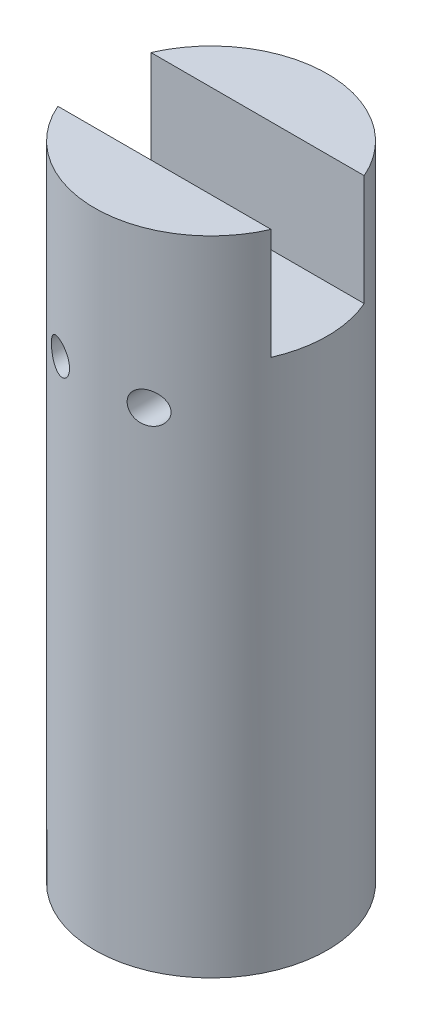
from build123d import *

# Parameters (mm, degrees)
SKETCH1_R               = 26.25
BOSS_EXTRUDE1_DEPTH     = 145
CUT_EXTRUDE1_DEPTH      = 25
CUT_EXTRUDE2_DEPTH      = 150.676734999
CUT_EXTRUDE2_DEPTH_BACK = 150.676734999
SKETCH3_R               = 3.5
SKETCH4_R               = 3.95
BOSS_EXTRUDE2_DEPTH     = 7
SKETCH5_R               = 5
BOSS_EXTRUDE3_DEPTH     = 1


with BuildPart() as part:
    # Sketch1 → Boss-Extrude1 (new body)
    with BuildSketch(Plane(origin=(0, 0, 0), x_dir=(1, 0, 0), z_dir=(0, 1, 0))):
        Circle(SKETCH1_R)
    extrude(amount=BOSS_EXTRUDE1_DEPTH)

    # Sketch2 → Cut-Extrude1 (cut)
    with BuildSketch(Plane(origin=(0, 145, 0), x_dir=(1, 0, 0), z_dir=(0, 1, 0))):
        with BuildLine():
            Line((-24.058522399, 10.5), (24.058522399, 10.5))
            ThreePointArc((24.058522399, 10.5), (34.558522399, 0), (24.058522399, -10.5))
            Line((24.058522399, -10.5), (-24.058522399, -10.5))
            ThreePointArc((-24.058522399, -10.5), (-34.558522399, 0), (-24.058522399, 10.5))
        make_face()
    extrude(amount=-CUT_EXTRUDE1_DEPTH, mode=Mode.SUBTRACT)

    # Sketch3 → Cut-Extrude2 (cut, two sides: drawn at the far end of the back side and taken through both)
    with BuildSketch(Plane.XY.offset(-CUT_EXTRUDE2_DEPTH_BACK)):
        with Locations((-10, 110)):
            Circle(SKETCH3_R)
        with Locations((10, 110)):
            Circle(SKETCH3_R)
    extrude(amount=CUT_EXTRUDE2_DEPTH + CUT_EXTRUDE2_DEPTH_BACK, mode=Mode.SUBTRACT)

    # Sketch4 → Boss-Extrude2 (add)
    with BuildSketch(Plane.XZ):
        Circle(SKETCH4_R)
    extrude(amount=BOSS_EXTRUDE2_DEPTH)

    # Sketch5 → Boss-Extrude3 (add)
    with BuildSketch(Plane.XZ):
        Circle(SKETCH5_R)
    extrude(amount=BOSS_EXTRUDE3_DEPTH)


solid = part.part
